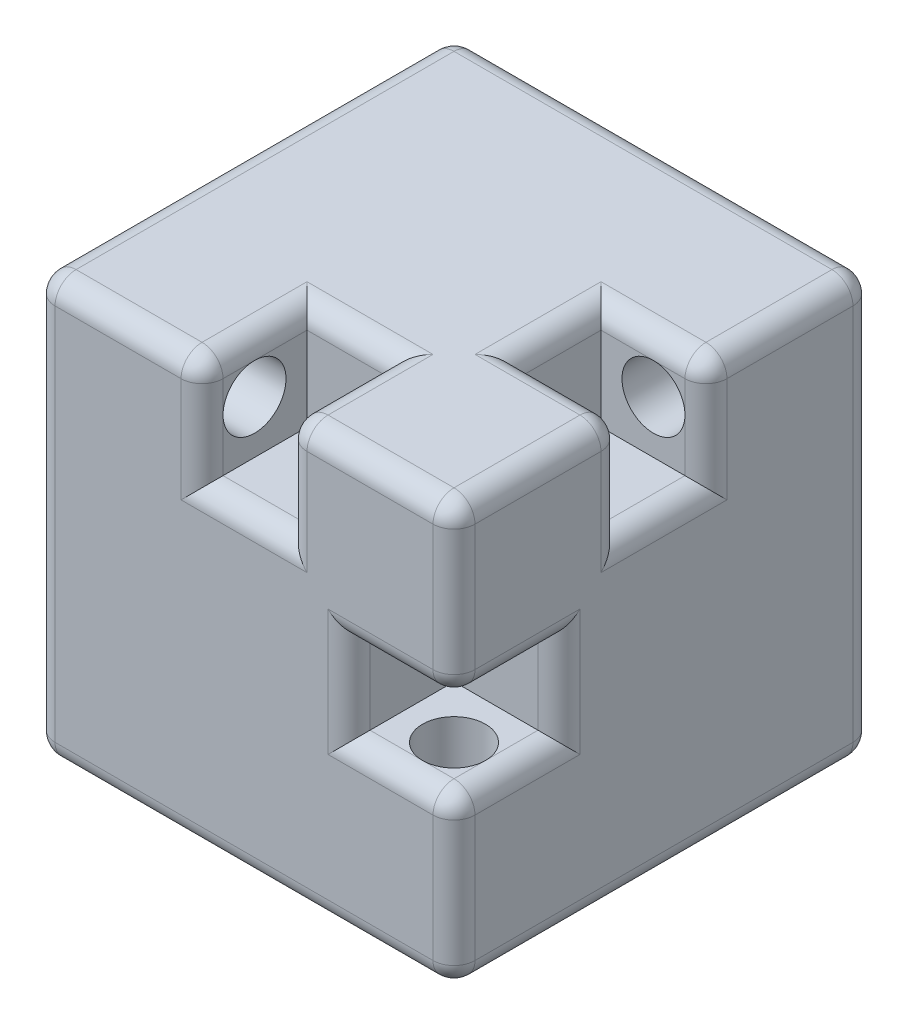
from build123d import *

# Parameters (mm, degrees)
SKETCH1_W           = 20
SKETCH1_H           = 20
BOSS_EXTRUDE1_DEPTH = 20
SKETCH2_W           = 4
SKETCH2_H           = 10
SKETCH2_W_2         = 10
SKETCH2_H_2         = 4
CUT_EXTRUDE1_DEPTH  = 5
SKETCH3_W           = 10
SKETCH3_H           = 4
CUT_EXTRUDE2_DEPTH  = 5
SKETCH4_R           = 1.5
CUT_EXTRUDE3_DEPTH  = 14
SKETCH5_R           = 1.5
CUT_EXTRUDE4_DEPTH  = 14
SKETCH6_R           = 1.5
CUT_EXTRUDE5_DEPTH  = 14
FILLET4_R           = 1


with BuildPart() as part:
    # Sketch1 → Boss-Extrude1 (new body)
    with BuildSketch(Plane(origin=(0, 0, 0), x_dir=(1, 0, 0), z_dir=(0, 1, 0))):
        Rectangle(SKETCH1_W, SKETCH1_H)
    extrude(amount=BOSS_EXTRUDE1_DEPTH)

    # Sketch2 → Cut-Extrude1 (cut)
    with BuildSketch(Plane.XY.offset(10)):
        with Locations((0, 20)):
            Rectangle(SKETCH2_W, SKETCH2_H)
        with Locations((10, 10)):
            Rectangle(SKETCH2_W_2, SKETCH2_H_2)
    extrude(amount=-CUT_EXTRUDE1_DEPTH, mode=Mode.SUBTRACT)

    # Sketch3 → Cut-Extrude2 (cut)
    with BuildSketch(Plane(origin=(0, 20, 0), x_dir=(1, 0, 0), z_dir=(0, 1, 0))):
        with Locations((10, 0)):
            Rectangle(SKETCH3_W, SKETCH3_H)
    extrude(amount=-CUT_EXTRUDE2_DEPTH, mode=Mode.SUBTRACT)

    # Sketch4 → Cut-Extrude3 (cut)
    with BuildSketch(Plane.ZY.offset(10)):
        with Locations((7.5, 17.5)):
            Circle(SKETCH4_R)
    extrude(amount=-CUT_EXTRUDE3_DEPTH, mode=Mode.SUBTRACT)

    # Sketch5 → Cut-Extrude4 (cut)
    with BuildSketch(Plane(origin=(0, 0, -10), x_dir=(-1, 0, 0), z_dir=(0, 0, -1))):
        with Locations((-7.5, 17.5)):
            Circle(SKETCH5_R)
    extrude(amount=-CUT_EXTRUDE4_DEPTH, mode=Mode.SUBTRACT)

    # Sketch6 → Cut-Extrude5 (cut)
    with BuildSketch(Plane.XZ):
        with Locations(Location((7.5, 7.5, 0), (0, 0, 270))):
            Circle(SKETCH6_R)
    extrude(amount=-CUT_EXTRUDE5_DEPTH, mode=Mode.SUBTRACT)

    # Fillet4
    # the kernel refuses this fillet: 1 mm, written as the material it takes off along each edge
    with BuildSketch(Plane(origin=(-9, 19, -9), x_dir=(0, 0, -1), z_dir=(-1, 0, 0))) as fillet4_piece_1_section:
        Polygon((0, 0), (FILLET4_R, 0), (FILLET4_R, -FILLET4_R), (0, -FILLET4_R), align=None)
    fillet4_piece_1 = extrude(amount=FILLET4_R, mode=Mode.PRIVATE)
    fillet4_piece_1 = fillet4_piece_1 - Plane(origin=(-9, 19, -9), x_dir=(0, -0.7071067811865475, 0.7071067811865475), z_dir=(-1, 0, 0)) * Sphere(FILLET4_R, mode=Mode.PRIVATE)
    add(fillet4_piece_1, mode=Mode.SUBTRACT)
    with BuildSketch(Plane(origin=(-9, 19, 9), x_dir=(-1, 0, 0), z_dir=(0, 0, 1))) as fillet4_piece_2_section:
        Polygon((0, 0), (FILLET4_R, 0), (FILLET4_R, -FILLET4_R), (0, -FILLET4_R), align=None)
    fillet4_piece_2 = extrude(amount=FILLET4_R, mode=Mode.PRIVATE)
    fillet4_piece_2 = fillet4_piece_2 - Plane(origin=(-9, 19, 9), x_dir=(0.7071067811865475, -0.7071067811865475, 0), z_dir=(0, 0, 1)) * Sphere(FILLET4_R, mode=Mode.PRIVATE)
    add(fillet4_piece_2, mode=Mode.SUBTRACT)
    with BuildSketch(Plane(origin=(-3, 19, 9), x_dir=(1, 0, 0), z_dir=(0, 0, 1))) as fillet4_piece_3_section:
        Polygon((0, 0), (FILLET4_R, 0), (FILLET4_R, FILLET4_R), (0, FILLET4_R), align=None)
    fillet4_piece_3 = extrude(amount=FILLET4_R, mode=Mode.PRIVATE)
    fillet4_piece_3 = fillet4_piece_3 - Plane(origin=(-3, 19, 9), x_dir=(-0.7071067811865475, -0.7071067811865475, 0), z_dir=(0, 0, 1)) * Sphere(FILLET4_R, mode=Mode.PRIVATE)
    add(fillet4_piece_3, mode=Mode.SUBTRACT)
    with BuildSketch(Plane(origin=(9, 1, 9), x_dir=(0, -1, 0), z_dir=(0, 0, 1))) as fillet4_piece_4_section:
        Polygon((0, 0), (FILLET4_R, 0), (FILLET4_R, FILLET4_R), (0, FILLET4_R), align=None)
    fillet4_piece_4 = extrude(amount=FILLET4_R, mode=Mode.PRIVATE)
    fillet4_piece_4 = fillet4_piece_4 - Plane(origin=(9, 1, 9), x_dir=(-0.7071067811865475, 0.7071067811865475, 0), z_dir=(0, 0, 1)) * Sphere(FILLET4_R, mode=Mode.PRIVATE)
    add(fillet4_piece_4, mode=Mode.SUBTRACT)
    with BuildSketch(Plane(origin=(9, 7, 9), x_dir=(1, 0, 0), z_dir=(0, 0, 1))) as fillet4_piece_5_section:
        Polygon((0, 0), (FILLET4_R, 0), (FILLET4_R, FILLET4_R), (0, FILLET4_R), align=None)
    fillet4_piece_5 = extrude(amount=FILLET4_R, mode=Mode.PRIVATE)
    fillet4_piece_5 = fillet4_piece_5 - Plane(origin=(9, 7, 9), x_dir=(-0.7071067811865488, -0.7071067811865461, 0), z_dir=(0, 0, 1)) * Sphere(FILLET4_R, mode=Mode.PRIVATE)
    add(fillet4_piece_5, mode=Mode.SUBTRACT)
    with BuildSketch(Plane(origin=(9, 13, 9), x_dir=(1, 0, 0), z_dir=(0, 0, 1))) as fillet4_piece_6_section:
        Polygon((0, 0), (FILLET4_R, 0), (FILLET4_R, -FILLET4_R), (0, -FILLET4_R), align=None)
    fillet4_piece_6 = extrude(amount=FILLET4_R, mode=Mode.PRIVATE)
    fillet4_piece_6 = fillet4_piece_6 - Plane(origin=(9, 13, 9), x_dir=(-0.7071067811865461, 0.7071067811865488, 0), z_dir=(0, 0, 1)) * Sphere(FILLET4_R, mode=Mode.PRIVATE)
    add(fillet4_piece_6, mode=Mode.SUBTRACT)
    with BuildSketch(Plane(origin=(3, 19, 9), x_dir=(0, 1, 0), z_dir=(0, 0, 1))) as fillet4_piece_7_section:
        Polygon((0, 0), (FILLET4_R, 0), (FILLET4_R, FILLET4_R), (0, FILLET4_R), align=None)
    fillet4_piece_7 = extrude(amount=FILLET4_R, mode=Mode.PRIVATE)
    fillet4_piece_7 = fillet4_piece_7 - Plane(origin=(3, 19, 9), x_dir=(0.7071067811865475, -0.7071067811865475, 0), z_dir=(0, 0, 1)) * Sphere(FILLET4_R, mode=Mode.PRIVATE)
    add(fillet4_piece_7, mode=Mode.SUBTRACT)
    with BuildSketch(Plane(origin=(9, 19, 9), x_dir=(1, 0, 0), z_dir=(0, 0, 1))) as fillet4_piece_8_section:
        Polygon((0, 0), (FILLET4_R, 0), (FILLET4_R, FILLET4_R), (0, FILLET4_R), align=None)
    fillet4_piece_8 = extrude(amount=FILLET4_R, mode=Mode.PRIVATE)
    fillet4_piece_8 = fillet4_piece_8 - Plane(origin=(9, 19, 9), x_dir=(-0.7071067811865475, -0.7071067811865475, 0), z_dir=(0, 0, 1)) * Sphere(FILLET4_R, mode=Mode.PRIVATE)
    add(fillet4_piece_8, mode=Mode.SUBTRACT)
    with BuildSketch(Plane(origin=(9, 19, 3), x_dir=(0, 1, 0), z_dir=(1, 0, 0))) as fillet4_piece_9_section:
        Polygon((0, 0), (FILLET4_R, 0), (FILLET4_R, -FILLET4_R), (0, -FILLET4_R), align=None)
    fillet4_piece_9 = extrude(amount=FILLET4_R, mode=Mode.PRIVATE)
    fillet4_piece_9 = fillet4_piece_9 - Plane(origin=(9, 19, 3), x_dir=(0, -0.7071067811865475, 0.7071067811865475), z_dir=(1, 0, 0)) * Sphere(FILLET4_R, mode=Mode.PRIVATE)
    add(fillet4_piece_9, mode=Mode.SUBTRACT)
    with BuildSketch(Plane(origin=(-9, 1, 9), x_dir=(0, -1, 0), z_dir=(0, 0, 1))) as fillet4_piece_10_section:
        Polygon((0, 0), (FILLET4_R, 0), (FILLET4_R, -FILLET4_R), (0, -FILLET4_R), align=None)
    fillet4_piece_10 = extrude(amount=FILLET4_R, mode=Mode.PRIVATE)
    fillet4_piece_10 = fillet4_piece_10 - Plane(origin=(-9, 1, 9), x_dir=(0.7071067811865475, 0.7071067811865475, 0), z_dir=(0, 0, 1)) * Sphere(FILLET4_R, mode=Mode.PRIVATE)
    add(fillet4_piece_10, mode=Mode.SUBTRACT)
    with BuildSketch(Plane(origin=(-9, 1, -9), x_dir=(-1, 0, 0), z_dir=(0, -1, 0))) as fillet4_piece_11_section:
        Polygon((0, 0), (FILLET4_R, 0), (FILLET4_R, FILLET4_R), (0, FILLET4_R), align=None)
    fillet4_piece_11 = extrude(amount=FILLET4_R, mode=Mode.PRIVATE)
    fillet4_piece_11 = fillet4_piece_11 - Plane(origin=(-9, 1, -9), x_dir=(0.7071067811865475, 0, 0.7071067811865475), z_dir=(0, -1, 0)) * Sphere(FILLET4_R, mode=Mode.PRIVATE)
    add(fillet4_piece_11, mode=Mode.SUBTRACT)
    with BuildSketch(Plane(origin=(9, 19, -3), x_dir=(0, 0, 1), z_dir=(1, 0, 0))) as fillet4_piece_12_section:
        Polygon((0, 0), (FILLET4_R, 0), (FILLET4_R, -FILLET4_R), (0, -FILLET4_R), align=None)
    fillet4_piece_12 = extrude(amount=FILLET4_R, mode=Mode.PRIVATE)
    fillet4_piece_12 = fillet4_piece_12 - Plane(origin=(9, 19, -3), x_dir=(0, -0.7071067811865475, -0.7071067811865475), z_dir=(1, 0, 0)) * Sphere(FILLET4_R, mode=Mode.PRIVATE)
    add(fillet4_piece_12, mode=Mode.SUBTRACT)
    with BuildSketch(Plane(origin=(9, 19, -9), x_dir=(0, 0, -1), z_dir=(1, 0, 0))) as fillet4_piece_13_section:
        Polygon((0, 0), (FILLET4_R, 0), (FILLET4_R, FILLET4_R), (0, FILLET4_R), align=None)
    fillet4_piece_13 = extrude(amount=FILLET4_R, mode=Mode.PRIVATE)
    fillet4_piece_13 = fillet4_piece_13 - Plane(origin=(9, 19, -9), x_dir=(0, -0.7071067811865475, 0.7071067811865475), z_dir=(1, 0, 0)) * Sphere(FILLET4_R, mode=Mode.PRIVATE)
    add(fillet4_piece_13, mode=Mode.SUBTRACT)
    with BuildSketch(Plane(origin=(9, 1, -9), x_dir=(1, 0, 0), z_dir=(0, -1, 0))) as fillet4_piece_14_section:
        Polygon((0, 0), (FILLET4_R, 0), (FILLET4_R, -FILLET4_R), (0, -FILLET4_R), align=None)
    fillet4_piece_14 = extrude(amount=FILLET4_R, mode=Mode.PRIVATE)
    fillet4_piece_14 = fillet4_piece_14 - Plane(origin=(9, 1, -9), x_dir=(-0.7071067811865475, 0, 0.7071067811865475), z_dir=(0, -1, 0)) * Sphere(FILLET4_R, mode=Mode.PRIVATE)
    add(fillet4_piece_14, mode=Mode.SUBTRACT)
    with BuildSketch(Plane(origin=(-10, 20, -9), x_dir=(1, 0, 0), z_dir=(0, 0, 1)), Plane(origin=(-9, 0, 10), x_dir=(0, 1, 0), z_dir=(1, 0, 0)), Plane(origin=(9, 20, -10), x_dir=(0, 0, 1), z_dir=(-1, 0, 0)), Plane(origin=(10, 1, -10), x_dir=(0, 0, 1), z_dir=(0, 1, 0))) as fillet4_piece_15:
        with BuildLine():
            CenterArc((FILLET4_R, -FILLET4_R), FILLET4_R, 90, 90)
            Line((0, -FILLET4_R), (0, 0))
            Line((0, 0), (FILLET4_R, 0))
        make_face()
    extrude(amount=18, mode=Mode.SUBTRACT)
    with BuildSketch(Plane(origin=(-9, 20, 10), x_dir=(0, -1, 0), z_dir=(1, 0, 0)), Plane(origin=(3, 20, 10), x_dir=(0, -1, 0), z_dir=(1, 0, 0)), Plane(origin=(10, 20, 9), x_dir=(0, -1, 0), z_dir=(0, 0, -1)), Plane(origin=(10, 20, -3), x_dir=(0, -1, 0), z_dir=(0, 0, -1))) as fillet4_piece_16:
        with BuildLine():
            CenterArc((FILLET4_R, FILLET4_R), FILLET4_R, 180, 90)
            Line((0, FILLET4_R), (0, 0))
            Line((0, 0), (FILLET4_R, 0))
        make_face()
    extrude(amount=6, mode=Mode.SUBTRACT)
    with BuildSketch(Plane(origin=(10, 1, 10), x_dir=(-1, 0, 0), z_dir=(0, 1, 0)), Plane(origin=(10, 13, 10), x_dir=(-1, 0, 0), z_dir=(0, 1, 0))) as fillet4_piece_17:
        with BuildLine():
            CenterArc((FILLET4_R, -FILLET4_R), FILLET4_R, 90, 90)
            Line((0, -FILLET4_R), (0, 0))
            Line((0, 0), (FILLET4_R, 0))
        make_face()
    extrude(amount=6, mode=Mode.SUBTRACT)
    with BuildSketch(Plane(origin=(9, 12, 10), x_dir=(0, 1, 0), z_dir=(-1, 0, 0)), Plane(origin=(10, 8, 5), x_dir=(0, 0, -1), z_dir=(0, 1, 0)), Plane(origin=(5, 12, 10), x_dir=(-1, 0, 0), z_dir=(0, -1, 0)), Plane(origin=(5, 8, 10), x_dir=(0, -1, 0), z_dir=(1, 0, 0)), Plane(origin=(-2, 20, 5), x_dir=(-1, 0, 0), z_dir=(0, 0, 1)), Plane(origin=(2, 20, 9), x_dir=(1, 0, 0), z_dir=(0, 0, -1)), Plane(origin=(-2, 19, 10), x_dir=(-1, 0, 0), z_dir=(0, -1, 0)), Plane(origin=(-2, 15, 10), x_dir=(0, -1, 0), z_dir=(1, 0, 0)), Plane(origin=(2, 15, 10), x_dir=(1, 0, 0), z_dir=(0, 1, 0)), Plane(origin=(9, 20, -2), x_dir=(0, 0, -1), z_dir=(-1, 0, 0)), Plane(origin=(10, 15, 2), x_dir=(0, -1, 0), z_dir=(0, 0, -1)), Plane(origin=(5, 20, -2), x_dir=(-1, 0, 0), z_dir=(0, 0, 1)), Plane(origin=(5, 20, 2), x_dir=(0, 0, 1), z_dir=(1, 0, 0))) as fillet4_piece_18:
        with BuildLine():
            CenterArc((FILLET4_R, FILLET4_R), FILLET4_R, 180, 90)
            Line((0, FILLET4_R), (0, 0))
            Line((0, 0), (FILLET4_R, 0))
        make_face()
    extrude(amount=4, mode=Mode.SUBTRACT)
    with BuildSketch(Plane(origin=(10, 8, 5), x_dir=(0, -1, 0), z_dir=(0, 0, 1)), Plane(origin=(10, 12, 9), x_dir=(0, 1, 0), z_dir=(0, 0, -1)), Plane(origin=(-2, 20, 5), x_dir=(0, 0, -1), z_dir=(1, 0, 0)), Plane(origin=(10, 15, 2), x_dir=(0, 0, 1), z_dir=(0, 1, 0)), Plane(origin=(10, 19, -2), x_dir=(0, 0, -1), z_dir=(0, -1, 0))) as fillet4_piece_19:
        with BuildLine():
            CenterArc((FILLET4_R, -FILLET4_R), FILLET4_R, 90, 90)
            Line((0, -FILLET4_R), (0, 0))
            Line((0, 0), (FILLET4_R, 0))
        make_face()
    extrude(amount=4, mode=Mode.SUBTRACT)
    with BuildSketch(Plane(origin=(-10, 0, -9), x_dir=(1, 0, 0), z_dir=(0, 0, 1)), Plane(origin=(9, 0, -10), x_dir=(0, 0, 1), z_dir=(-1, 0, 0)), Plane(origin=(10, 0, 9), x_dir=(-1, 0, 0), z_dir=(0, 0, -1)), Plane(origin=(-10, 1, 10), x_dir=(1, 0, 0), z_dir=(0, 1, 0)), Plane(origin=(-10, 1, -10), x_dir=(0, 0, 1), z_dir=(0, 1, 0))) as fillet4_piece_20:
        with BuildLine():
            CenterArc((FILLET4_R, FILLET4_R), FILLET4_R, 180, 90)
            Line((0, FILLET4_R), (0, 0))
            Line((0, 0), (FILLET4_R, 0))
        make_face()
    extrude(amount=18, mode=Mode.SUBTRACT)
    with BuildSketch(Plane(origin=(-10, 17.5, 7.5), x_dir=(0, 0, 1), z_dir=(0, -1, 0))) as fillet4_piece_21:
        with BuildLine():
            CenterArc((1.5 + FILLET4_R, -FILLET4_R), FILLET4_R, 90, 90)
            Line((1.5, -FILLET4_R), (1.5, 0))
            Line((1.5, 0), (1.5 + FILLET4_R, 0))
        make_face()
    revolve(axis=Axis((-10, 17.5, 7.5), (-1, 0, 0)), mode=Mode.SUBTRACT)
    with BuildSketch(Plane(origin=(7.5, 17.5, -10), x_dir=(-1, 0, 0), z_dir=(0, -1, 0))) as fillet4_piece_22:
        with BuildLine():
            CenterArc((1.5 + FILLET4_R, -FILLET4_R), FILLET4_R, 90, 90)
            Line((1.5, -FILLET4_R), (1.5, 0))
            Line((1.5, 0), (1.5 + FILLET4_R, 0))
        make_face()
    revolve(axis=Axis((7.5, 17.5, -10), (0, 0, -1)), mode=Mode.SUBTRACT)
    with BuildSketch(Plane(origin=(7.5, 0, 7.5), x_dir=(0, 0, -1), z_dir=(-1, 0, 0))) as fillet4_piece_23:
        with BuildLine():
            CenterArc((1.5 + FILLET4_R, -FILLET4_R), FILLET4_R, 90, 90)
            Line((1.5, -FILLET4_R), (1.5, 0))
            Line((1.5, 0), (1.5 + FILLET4_R, 0))
        make_face()
    revolve(axis=Axis((7.5, 0, 7.5), (0, -1, 0)), mode=Mode.SUBTRACT)
    with BuildSketch(Plane(origin=(5, 14.5, 10), x_dir=(-1, 0, 0), z_dir=(0, -1, 0))) as fillet4_piece_24a_section:
        with BuildLine():
            CenterArc((FILLET4_R, FILLET4_R), FILLET4_R, 180, 90)
            Line((0, FILLET4_R), (0, 0))
            Line((0, 0), (FILLET4_R, 0))
        make_face()
    fillet4_piece_24a = extrude(amount=6.5, mode=Mode.PRIVATE)
    fillet4_piece_24a = split(fillet4_piece_24a, bisect_by=Plane(origin=(4.773604886, 12, 9.773604886), z_dir=(0, 1, 0)), keep=Keep.TOP, mode=Mode.PRIVATE)
    with BuildSketch(Plane(origin=(9, 12, 10), x_dir=(0, 1, 0), z_dir=(-1, 0, 0))) as fillet4_piece_24b_section:
        with BuildLine():
            CenterArc((FILLET4_R, FILLET4_R), FILLET4_R, 180, 90)
            Line((0, FILLET4_R), (0, 0))
            Line((0, 0), (FILLET4_R, 0))
        make_face()
    fillet4_piece_24b = extrude(amount=6.5, mode=Mode.PRIVATE)
    fillet4_piece_24b = split(fillet4_piece_24b, bisect_by=Plane(origin=(5, 12.226395114, 9.773604886), z_dir=(-1, 0, 0)), keep=Keep.TOP, mode=Mode.PRIVATE)
    fillet4_piece_24 = fillet4_piece_24a & fillet4_piece_24b
    add(fillet4_piece_24, mode=Mode.SUBTRACT)
    with BuildSketch(Plane(origin=(10, 5.5, 5), x_dir=(0, 0, -1), z_dir=(0, 1, 0))) as fillet4_piece_25a_section:
        with BuildLine():
            CenterArc((FILLET4_R, FILLET4_R), FILLET4_R, 180, 90)
            Line((0, FILLET4_R), (0, 0))
            Line((0, 0), (FILLET4_R, 0))
        make_face()
    fillet4_piece_25a = extrude(amount=6.5, mode=Mode.PRIVATE)
    fillet4_piece_25a = split(fillet4_piece_25a, bisect_by=Plane(origin=(9.773604886, 8, 4.773604886), z_dir=(0, -1, 0)), keep=Keep.TOP, mode=Mode.PRIVATE)
    with BuildSketch(Plane(origin=(10, 8, 2.5), x_dir=(0, -1, 0), z_dir=(0, 0, 1))) as fillet4_piece_25b_section:
        with BuildLine():
            CenterArc((FILLET4_R, -FILLET4_R), FILLET4_R, 90, 90)
            Line((0, -FILLET4_R), (0, 0))
            Line((0, 0), (FILLET4_R, 0))
        make_face()
    fillet4_piece_25b = extrude(amount=6.5, mode=Mode.PRIVATE)
    fillet4_piece_25b = split(fillet4_piece_25b, bisect_by=Plane(origin=(9.773604886, 7.773604886, 5), z_dir=(0, 0, -1)), keep=Keep.TOP, mode=Mode.PRIVATE)
    fillet4_piece_25 = fillet4_piece_25a & fillet4_piece_25b
    add(fillet4_piece_25, mode=Mode.SUBTRACT)
    with BuildSketch(Plane(origin=(10, 12, 9), x_dir=(0, 1, 0), z_dir=(0, 0, -1))) as fillet4_piece_26a_section:
        with BuildLine():
            CenterArc((FILLET4_R, -FILLET4_R), FILLET4_R, 90, 90)
            Line((0, -FILLET4_R), (0, 0))
            Line((0, 0), (FILLET4_R, 0))
        make_face()
    fillet4_piece_26a = extrude(amount=6.5, mode=Mode.PRIVATE)
    fillet4_piece_26a = split(fillet4_piece_26a, bisect_by=Plane(origin=(9.773604886, 12.226395114, 5), z_dir=(0, 0, -1)), keep=Keep.TOP, mode=Mode.PRIVATE)
    with BuildSketch(Plane(origin=(10, 8, 5), x_dir=(0, 0, -1), z_dir=(0, 1, 0))) as fillet4_piece_26b_section:
        with BuildLine():
            CenterArc((FILLET4_R, FILLET4_R), FILLET4_R, 180, 90)
            Line((0, FILLET4_R), (0, 0))
            Line((0, 0), (FILLET4_R, 0))
        make_face()
    fillet4_piece_26b = extrude(amount=6.5, mode=Mode.PRIVATE)
    fillet4_piece_26b = split(fillet4_piece_26b, bisect_by=Plane(origin=(9.773604886, 12, 4.773604886), z_dir=(0, 1, 0)), keep=Keep.TOP, mode=Mode.PRIVATE)
    fillet4_piece_26 = fillet4_piece_26a & fillet4_piece_26b
    add(fillet4_piece_26, mode=Mode.SUBTRACT)
    with BuildSketch(Plane(origin=(2.5, 8, 10), x_dir=(0, -1, 0), z_dir=(1, 0, 0))) as fillet4_piece_27a_section:
        with BuildLine():
            CenterArc((FILLET4_R, FILLET4_R), FILLET4_R, 180, 90)
            Line((0, FILLET4_R), (0, 0))
            Line((0, 0), (FILLET4_R, 0))
        make_face()
    fillet4_piece_27a = extrude(amount=6.5, mode=Mode.PRIVATE)
    fillet4_piece_27a = split(fillet4_piece_27a, bisect_by=Plane(origin=(5, 7.773604886, 9.773604886), z_dir=(-1, 0, 0)), keep=Keep.TOP, mode=Mode.PRIVATE)
    with BuildSketch(Plane(origin=(5, 12, 10), x_dir=(-1, 0, 0), z_dir=(0, -1, 0))) as fillet4_piece_27b_section:
        with BuildLine():
            CenterArc((FILLET4_R, FILLET4_R), FILLET4_R, 180, 90)
            Line((0, FILLET4_R), (0, 0))
            Line((0, 0), (FILLET4_R, 0))
        make_face()
    fillet4_piece_27b = extrude(amount=6.5, mode=Mode.PRIVATE)
    fillet4_piece_27b = split(fillet4_piece_27b, bisect_by=Plane(origin=(4.773604886, 8, 9.773604886), z_dir=(0, -1, 0)), keep=Keep.TOP, mode=Mode.PRIVATE)
    fillet4_piece_27 = fillet4_piece_27a & fillet4_piece_27b
    add(fillet4_piece_27, mode=Mode.SUBTRACT)
    with BuildSketch(Plane(origin=(-4.5, 20, 5), x_dir=(0, 0, -1), z_dir=(1, 0, 0))) as fillet4_piece_28a_section:
        with BuildLine():
            CenterArc((FILLET4_R, -FILLET4_R), FILLET4_R, 90, 90)
            Line((0, -FILLET4_R), (0, 0))
            Line((0, 0), (FILLET4_R, 0))
        make_face()
    fillet4_piece_28a = extrude(amount=6.5, mode=Mode.PRIVATE)
    fillet4_piece_28a = split(fillet4_piece_28a, bisect_by=Plane(origin=(-2, 19.773604886, 4.773604886), z_dir=(-1, 0, 0)), keep=Keep.TOP, mode=Mode.PRIVATE)
    with BuildSketch(Plane(origin=(-2, 20, 2.5), x_dir=(-1, 0, 0), z_dir=(0, 0, 1))) as fillet4_piece_28b_section:
        with BuildLine():
            CenterArc((FILLET4_R, FILLET4_R), FILLET4_R, 180, 90)
            Line((0, FILLET4_R), (0, 0))
            Line((0, 0), (FILLET4_R, 0))
        make_face()
    fillet4_piece_28b = extrude(amount=6.5, mode=Mode.PRIVATE)
    fillet4_piece_28b = split(fillet4_piece_28b, bisect_by=Plane(origin=(-2.226395114, 19.773604886, 5), z_dir=(0, 0, -1)), keep=Keep.TOP, mode=Mode.PRIVATE)
    fillet4_piece_28 = fillet4_piece_28a & fillet4_piece_28b
    add(fillet4_piece_28, mode=Mode.SUBTRACT)
    with BuildSketch(Plane(origin=(2, 20, 9), x_dir=(1, 0, 0), z_dir=(0, 0, -1))) as fillet4_piece_29a_section:
        with BuildLine():
            CenterArc((FILLET4_R, FILLET4_R), FILLET4_R, 180, 90)
            Line((0, FILLET4_R), (0, 0))
            Line((0, 0), (FILLET4_R, 0))
        make_face()
    fillet4_piece_29a = extrude(amount=6.5, mode=Mode.PRIVATE)
    fillet4_piece_29a = split(fillet4_piece_29a, bisect_by=Plane(origin=(2.226395114, 19.773604886, 5), z_dir=(0, 0, -1)), keep=Keep.TOP, mode=Mode.PRIVATE)
    with BuildSketch(Plane(origin=(-2, 20, 5), x_dir=(0, 0, -1), z_dir=(1, 0, 0))) as fillet4_piece_29b_section:
        with BuildLine():
            CenterArc((FILLET4_R, -FILLET4_R), FILLET4_R, 90, 90)
            Line((0, -FILLET4_R), (0, 0))
            Line((0, 0), (FILLET4_R, 0))
        make_face()
    fillet4_piece_29b = extrude(amount=6.5, mode=Mode.PRIVATE)
    fillet4_piece_29b = split(fillet4_piece_29b, bisect_by=Plane(origin=(2, 19.773604886, 4.773604886), z_dir=(1, 0, 0)), keep=Keep.TOP, mode=Mode.PRIVATE)
    fillet4_piece_29 = fillet4_piece_29a & fillet4_piece_29b
    add(fillet4_piece_29, mode=Mode.SUBTRACT)
    with BuildSketch(Plane(origin=(-4.5, 15, 10), x_dir=(0, -1, 0), z_dir=(1, 0, 0))) as fillet4_piece_30a_section:
        with BuildLine():
            CenterArc((FILLET4_R, FILLET4_R), FILLET4_R, 180, 90)
            Line((0, FILLET4_R), (0, 0))
            Line((0, 0), (FILLET4_R, 0))
        make_face()
    fillet4_piece_30a = extrude(amount=6.5, mode=Mode.PRIVATE)
    fillet4_piece_30a = split(fillet4_piece_30a, bisect_by=Plane(origin=(-2, 14.773604886, 9.773604886), z_dir=(-1, 0, 0)), keep=Keep.TOP, mode=Mode.PRIVATE)
    with BuildSketch(Plane(origin=(-2, 19, 10), x_dir=(-1, 0, 0), z_dir=(0, -1, 0))) as fillet4_piece_30b_section:
        with BuildLine():
            CenterArc((FILLET4_R, FILLET4_R), FILLET4_R, 180, 90)
            Line((0, FILLET4_R), (0, 0))
            Line((0, 0), (FILLET4_R, 0))
        make_face()
    fillet4_piece_30b = extrude(amount=6.5, mode=Mode.PRIVATE)
    fillet4_piece_30b = split(fillet4_piece_30b, bisect_by=Plane(origin=(-2.226395114, 15, 9.773604886), z_dir=(0, -1, 0)), keep=Keep.TOP, mode=Mode.PRIVATE)
    fillet4_piece_30 = fillet4_piece_30a & fillet4_piece_30b
    add(fillet4_piece_30, mode=Mode.SUBTRACT)
    with BuildSketch(Plane(origin=(2, 12.5, 10), x_dir=(1, 0, 0), z_dir=(0, 1, 0))) as fillet4_piece_31a_section:
        with BuildLine():
            CenterArc((FILLET4_R, FILLET4_R), FILLET4_R, 180, 90)
            Line((0, FILLET4_R), (0, 0))
            Line((0, 0), (FILLET4_R, 0))
        make_face()
    fillet4_piece_31a = extrude(amount=6.5, mode=Mode.PRIVATE)
    fillet4_piece_31a = split(fillet4_piece_31a, bisect_by=Plane(origin=(2.226395114, 15, 9.773604886), z_dir=(0, -1, 0)), keep=Keep.TOP, mode=Mode.PRIVATE)
    with BuildSketch(Plane(origin=(-2, 15, 10), x_dir=(0, -1, 0), z_dir=(1, 0, 0))) as fillet4_piece_31b_section:
        with BuildLine():
            CenterArc((FILLET4_R, FILLET4_R), FILLET4_R, 180, 90)
            Line((0, FILLET4_R), (0, 0))
            Line((0, 0), (FILLET4_R, 0))
        make_face()
    fillet4_piece_31b = extrude(amount=6.5, mode=Mode.PRIVATE)
    fillet4_piece_31b = split(fillet4_piece_31b, bisect_by=Plane(origin=(2, 14.773604886, 9.773604886), z_dir=(1, 0, 0)), keep=Keep.TOP, mode=Mode.PRIVATE)
    fillet4_piece_31 = fillet4_piece_31a & fillet4_piece_31b
    add(fillet4_piece_31, mode=Mode.SUBTRACT)
    with BuildSketch(Plane(origin=(9, 20, -2), x_dir=(0, 0, -1), z_dir=(-1, 0, 0))) as fillet4_piece_32a_section:
        with BuildLine():
            CenterArc((FILLET4_R, FILLET4_R), FILLET4_R, 180, 90)
            Line((0, FILLET4_R), (0, 0))
            Line((0, 0), (FILLET4_R, 0))
        make_face()
    fillet4_piece_32a = extrude(amount=6.5, mode=Mode.PRIVATE)
    fillet4_piece_32a = split(fillet4_piece_32a, bisect_by=Plane(origin=(5, 19.773604886, -2.226395114), z_dir=(-1, 0, 0)), keep=Keep.TOP, mode=Mode.PRIVATE)
    with BuildSketch(Plane(origin=(5, 20, -4.5), x_dir=(-1, 0, 0), z_dir=(0, 0, 1))) as fillet4_piece_32b_section:
        with BuildLine():
            CenterArc((FILLET4_R, FILLET4_R), FILLET4_R, 180, 90)
            Line((0, FILLET4_R), (0, 0))
            Line((0, 0), (FILLET4_R, 0))
        make_face()
    fillet4_piece_32b = extrude(amount=6.5, mode=Mode.PRIVATE)
    fillet4_piece_32b = split(fillet4_piece_32b, bisect_by=Plane(origin=(4.773604886, 19.773604886, -2), z_dir=(0, 0, -1)), keep=Keep.TOP, mode=Mode.PRIVATE)
    fillet4_piece_32 = fillet4_piece_32a & fillet4_piece_32b
    add(fillet4_piece_32, mode=Mode.SUBTRACT)
    with BuildSketch(Plane(origin=(10, 15, 4.5), x_dir=(0, -1, 0), z_dir=(0, 0, -1))) as fillet4_piece_33a_section:
        with BuildLine():
            CenterArc((FILLET4_R, FILLET4_R), FILLET4_R, 180, 90)
            Line((0, FILLET4_R), (0, 0))
            Line((0, 0), (FILLET4_R, 0))
        make_face()
    fillet4_piece_33a = extrude(amount=6.5, mode=Mode.PRIVATE)
    fillet4_piece_33a = split(fillet4_piece_33a, bisect_by=Plane(origin=(9.773604886, 14.773604886, 2), z_dir=(0, 0, 1)), keep=Keep.TOP, mode=Mode.PRIVATE)
    with BuildSketch(Plane(origin=(10, 12.5, 2), x_dir=(0, 0, 1), z_dir=(0, 1, 0))) as fillet4_piece_33b_section:
        with BuildLine():
            CenterArc((FILLET4_R, -FILLET4_R), FILLET4_R, 90, 90)
            Line((0, -FILLET4_R), (0, 0))
            Line((0, 0), (FILLET4_R, 0))
        make_face()
    fillet4_piece_33b = extrude(amount=6.5, mode=Mode.PRIVATE)
    fillet4_piece_33b = split(fillet4_piece_33b, bisect_by=Plane(origin=(9.773604886, 15, 2.226395114), z_dir=(0, -1, 0)), keep=Keep.TOP, mode=Mode.PRIVATE)
    fillet4_piece_33 = fillet4_piece_33a & fillet4_piece_33b
    add(fillet4_piece_33, mode=Mode.SUBTRACT)
    with BuildSketch(Plane(origin=(10, 19, -2), x_dir=(0, 0, -1), z_dir=(0, -1, 0))) as fillet4_piece_34a_section:
        with BuildLine():
            CenterArc((FILLET4_R, -FILLET4_R), FILLET4_R, 90, 90)
            Line((0, -FILLET4_R), (0, 0))
            Line((0, 0), (FILLET4_R, 0))
        make_face()
    fillet4_piece_34a = extrude(amount=6.5, mode=Mode.PRIVATE)
    fillet4_piece_34a = split(fillet4_piece_34a, bisect_by=Plane(origin=(9.773604886, 15, -2.226395114), z_dir=(0, -1, 0)), keep=Keep.TOP, mode=Mode.PRIVATE)
    with BuildSketch(Plane(origin=(10, 15, 2), x_dir=(0, -1, 0), z_dir=(0, 0, -1))) as fillet4_piece_34b_section:
        with BuildLine():
            CenterArc((FILLET4_R, FILLET4_R), FILLET4_R, 180, 90)
            Line((0, FILLET4_R), (0, 0))
            Line((0, 0), (FILLET4_R, 0))
        make_face()
    fillet4_piece_34b = extrude(amount=6.5, mode=Mode.PRIVATE)
    fillet4_piece_34b = split(fillet4_piece_34b, bisect_by=Plane(origin=(9.773604886, 14.773604886, -2), z_dir=(0, 0, -1)), keep=Keep.TOP, mode=Mode.PRIVATE)
    fillet4_piece_34 = fillet4_piece_34a & fillet4_piece_34b
    add(fillet4_piece_34, mode=Mode.SUBTRACT)
    with BuildSketch(Plane(origin=(5, 20, -2), x_dir=(-1, 0, 0), z_dir=(0, 0, 1))) as fillet4_piece_35a_section:
        with BuildLine():
            CenterArc((FILLET4_R, FILLET4_R), FILLET4_R, 180, 90)
            Line((0, FILLET4_R), (0, 0))
            Line((0, 0), (FILLET4_R, 0))
        make_face()
    fillet4_piece_35a = extrude(amount=6.5, mode=Mode.PRIVATE)
    fillet4_piece_35a = split(fillet4_piece_35a, bisect_by=Plane(origin=(4.773604886, 19.773604886, 2), z_dir=(0, 0, 1)), keep=Keep.TOP, mode=Mode.PRIVATE)
    with BuildSketch(Plane(origin=(2.5, 20, 2), x_dir=(0, 0, 1), z_dir=(1, 0, 0))) as fillet4_piece_35b_section:
        with BuildLine():
            CenterArc((FILLET4_R, FILLET4_R), FILLET4_R, 180, 90)
            Line((0, FILLET4_R), (0, 0))
            Line((0, 0), (FILLET4_R, 0))
        make_face()
    fillet4_piece_35b = extrude(amount=6.5, mode=Mode.PRIVATE)
    fillet4_piece_35b = split(fillet4_piece_35b, bisect_by=Plane(origin=(5, 19.773604886, 2.226395114), z_dir=(-1, 0, 0)), keep=Keep.TOP, mode=Mode.PRIVATE)
    fillet4_piece_35 = fillet4_piece_35a & fillet4_piece_35b
    add(fillet4_piece_35, mode=Mode.SUBTRACT)


solid = part.part
